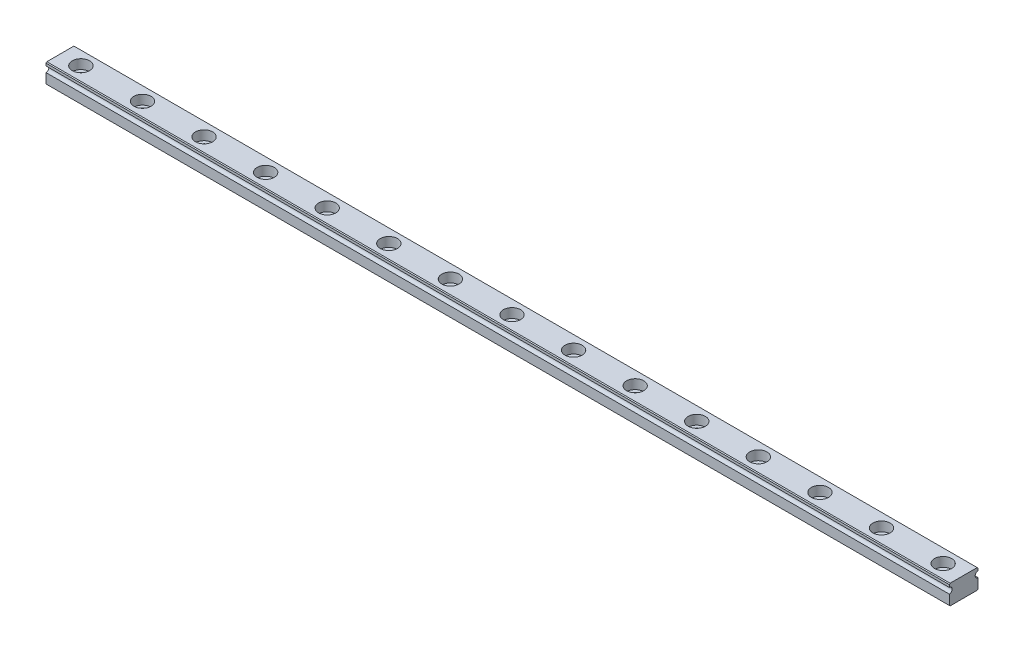
from build123d import *

# Parameters (mm, degrees)
EXTRUDE_1_DEPTH          = 220
SKETCH_2_R               = 2.1
CUT_EXTRUDE_1_DEPTH      = 2.3
CUT_EXTRUDE_2_DEPTH      = 221.080070328
CUT_EXTRUDE_2_DEPTH_BACK = 221.080070328
SKETCH_3_R               = 1.2


with BuildPart() as part:
    # 草图1 → 凸台-拉伸1 (new body)
    with BuildSketch(Plane(origin=(0, 0, 0), x_dir=(0, 0, -1), z_dir=(1, 0, 0))):
        with BuildLine():
            Line((3.497989899, 0.202010101), (3.497989899, -2.197989899))
            Line((3.497989899, -2.197989899), (3.3, -2.395979797))
            Line((3.3, -2.395979797), (-3.3, -2.395979797))
            Line((-3.3, -2.395979797), (-3.497989899, -2.197989899))
            Line((-3.497989899, -2.197989899), (-3.497989899, 0.202010101))
            ThreePointArc((-3.497989899, 0.202010101), (-2.797989899, 0.902010101), (-3.497989899, 1.602010101))
            Line((-3.497989899, 1.602010101), (-3.497989899, 2.202010101))
            Line((-3.497989899, 2.202010101), (-3.3, 2.4))
            Line((-3.3, 2.4), (3.3, 2.4))
            Line((3.3, 2.4), (3.497989899, 2.202010101))
            Line((3.497989899, 2.202010101), (3.497989899, 1.602010101))
            ThreePointArc((3.497989899, 1.602010101), (2.797989899, 0.902010101), (3.497989899, 0.202010101))
        make_face()
    extrude(amount=EXTRUDE_1_DEPTH)

    # 草图2 → 切除-拉伸1 (cut)
    with BuildSketch(Plane(origin=(0, 2.4, 0), x_dir=(1, 0, 0), z_dir=(0, 1, 0))):
        with Locations((5, 0)):
            Circle(SKETCH_2_R)
        with Locations((20, 0)):
            Circle(SKETCH_2_R)
        with Locations((35, 0)):
            Circle(SKETCH_2_R)
        with Locations((50, 0)):
            Circle(SKETCH_2_R)
        with Locations((65, 0)):
            Circle(SKETCH_2_R)
        with Locations((80, 0)):
            Circle(SKETCH_2_R)
        with Locations((95, 0)):
            Circle(SKETCH_2_R)
        with Locations((110, 0)):
            Circle(SKETCH_2_R)
        with Locations((125, 0)):
            Circle(SKETCH_2_R)
        with Locations((140, 0)):
            Circle(SKETCH_2_R)
        with Locations((155, 0)):
            Circle(SKETCH_2_R)
        with Locations((170, 0)):
            Circle(SKETCH_2_R)
        with Locations((185, 0)):
            Circle(SKETCH_2_R)
        with Locations((200, 0)):
            Circle(SKETCH_2_R)
        with Locations((215, 0)):
            Circle(SKETCH_2_R)
    extrude(amount=-CUT_EXTRUDE_1_DEPTH, mode=Mode.SUBTRACT)

    # 草图3 → 切除-拉伸2 (cut, two sides: drawn at the far end of the back side and taken through both)
    with BuildSketch(Plane(origin=(0, 2.4, 0), x_dir=(1, 0, 0), z_dir=(0, 1, 0)).offset(-CUT_EXTRUDE_2_DEPTH_BACK)):
        with Locations((5, 0)):
            Circle(SKETCH_3_R)
        with Locations((20, 0)):
            Circle(SKETCH_3_R)
        with Locations((35, 0)):
            Circle(SKETCH_3_R)
        with Locations((50, 0)):
            Circle(SKETCH_3_R)
        with Locations((65, 0)):
            Circle(SKETCH_3_R)
        with Locations((80, 0)):
            Circle(SKETCH_3_R)
        with Locations((95, 0)):
            Circle(SKETCH_3_R)
        with Locations((110, 0)):
            Circle(SKETCH_3_R)
        with Locations((125, 0)):
            Circle(SKETCH_3_R)
        with Locations((140, 0)):
            Circle(SKETCH_3_R)
        with Locations((155, 0)):
            Circle(SKETCH_3_R)
        with Locations((170, 0)):
            Circle(SKETCH_3_R)
        with Locations((185, 0)):
            Circle(SKETCH_3_R)
        with Locations((200, 0)):
            Circle(SKETCH_3_R)
        with Locations((215, 0)):
            Circle(SKETCH_3_R)
    extrude(amount=CUT_EXTRUDE_2_DEPTH + CUT_EXTRUDE_2_DEPTH_BACK, mode=Mode.SUBTRACT)


solid = part.part
